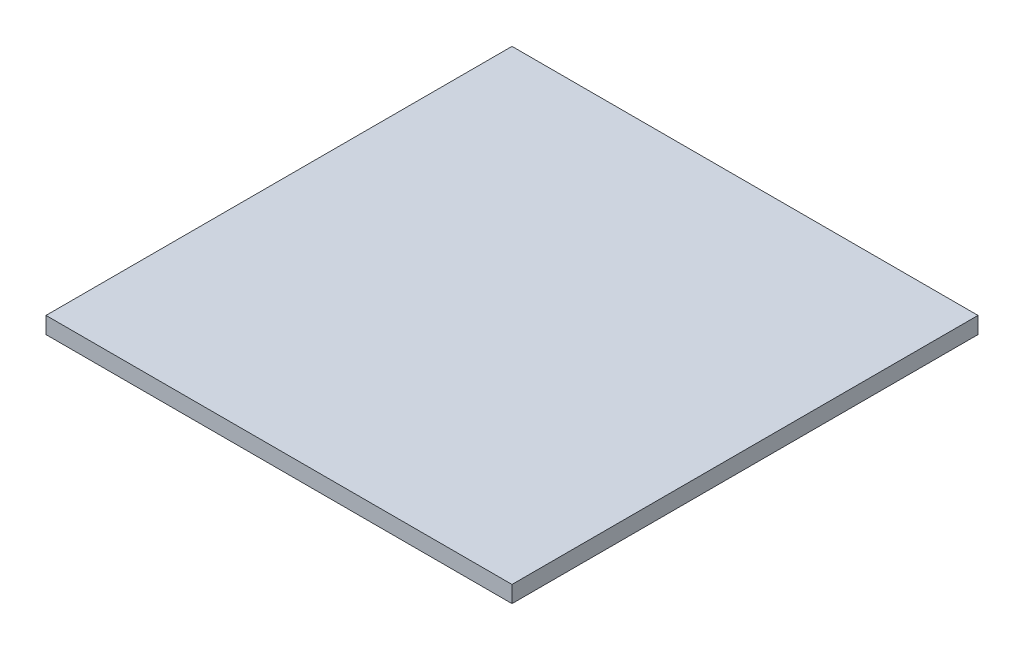
from build123d import *

# Parameters (mm, degrees)
SKETCH1_W           = 140
SKETCH1_H           = 140
BOSS_EXTRUDE1_DEPTH = 5


with BuildPart() as part:
    # Sketch1 → Boss-Extrude1 (new body)
    with BuildSketch(Plane(origin=(0, 0, 0), x_dir=(1, 0, 0), z_dir=(0, 1, 0))):
        Rectangle(SKETCH1_W, SKETCH1_H)
    extrude(amount=BOSS_EXTRUDE1_DEPTH)


solid = part.part
